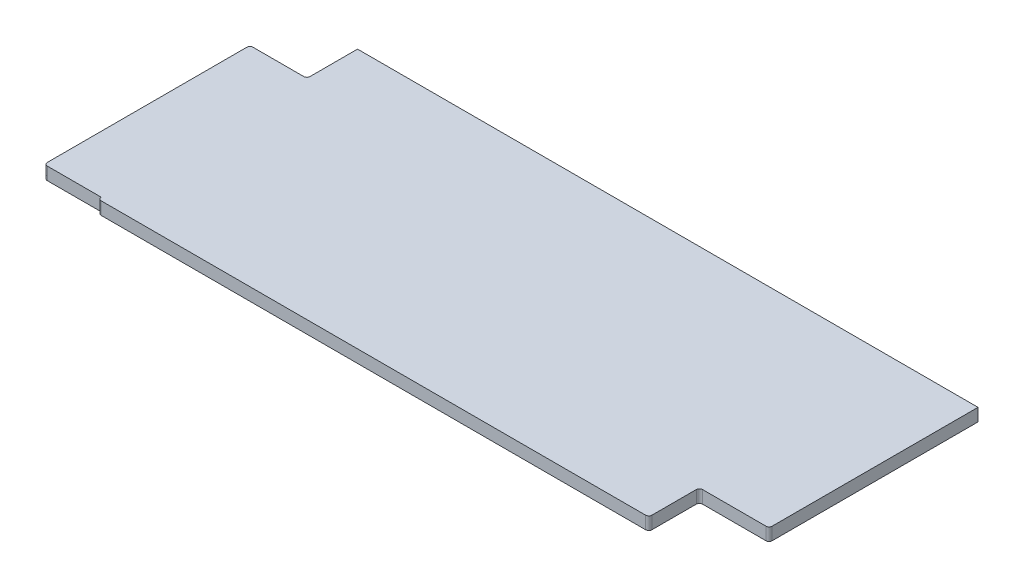
from build123d import *

# Parameters (mm, degrees)
EXTRUDE_1_DEPTH = 4
SKETCH_2_W      = 18
SKETCH_2_H      = 65
EXTRUDE_2_DEPTH = 4
FILLET_1_R      = 1


with BuildPart() as part:
    # 草图1 → 凸台-拉伸1 (new body)
    with BuildSketch(Plane(origin=(0, 0, 0), x_dir=(1, 0, 0), z_dir=(0, 1, 0))):
        Polygon((0, -66), (0, 0), (-196, 0), (-196, -82), (-22, -82), (-22, -66), align=None)
    extrude(amount=EXTRUDE_1_DEPTH)

    # 草图2 → 凸台-拉伸2 (add)
    with BuildSketch(Plane(origin=(0, 4, 0), x_dir=(1, 0, 0), z_dir=(0, 1, 0))):
        with Locations((-205, -48.5)):
            Rectangle(SKETCH_2_W, SKETCH_2_H)
    extrude(amount=-EXTRUDE_2_DEPTH)

    # 圆角1
    fillet_1_edges = [part.edges().sort_by_distance(p)[0] for p in [
        (-22, 2, 82),
        (-196, 2, 82),
        (0, 2, 66),
        (-22, 2, 66),
        (-196, 2, 16),
        (-214, 2, 81),
        (-214, 2, 16),
    ]]
    fillet(fillet_1_edges, radius=FILLET_1_R - 0.0001)  # a hair under: the kernel refuses the full size


solid = part.part
